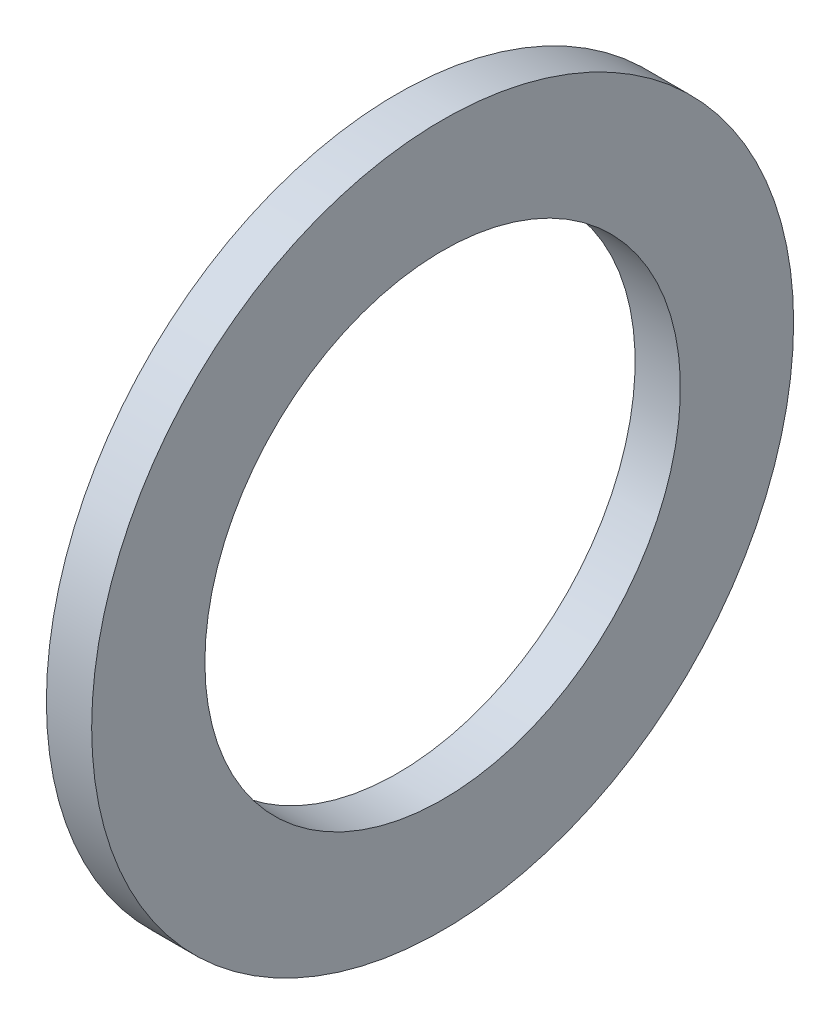
from build123d import *

# Parameters (mm, degrees)
SKETCH1_W = 2
SKETCH1_H = 5


with BuildPart() as part:
    # Sketch1 → Base-Revolve (revolve)
    with BuildSketch(Plane.XY):
        with Locations((-1, 13)):
            Rectangle(SKETCH1_W, SKETCH1_H)
    revolve(axis=Axis((-34.925, 0, 0), (1, 0, 0)))


solid = part.part
